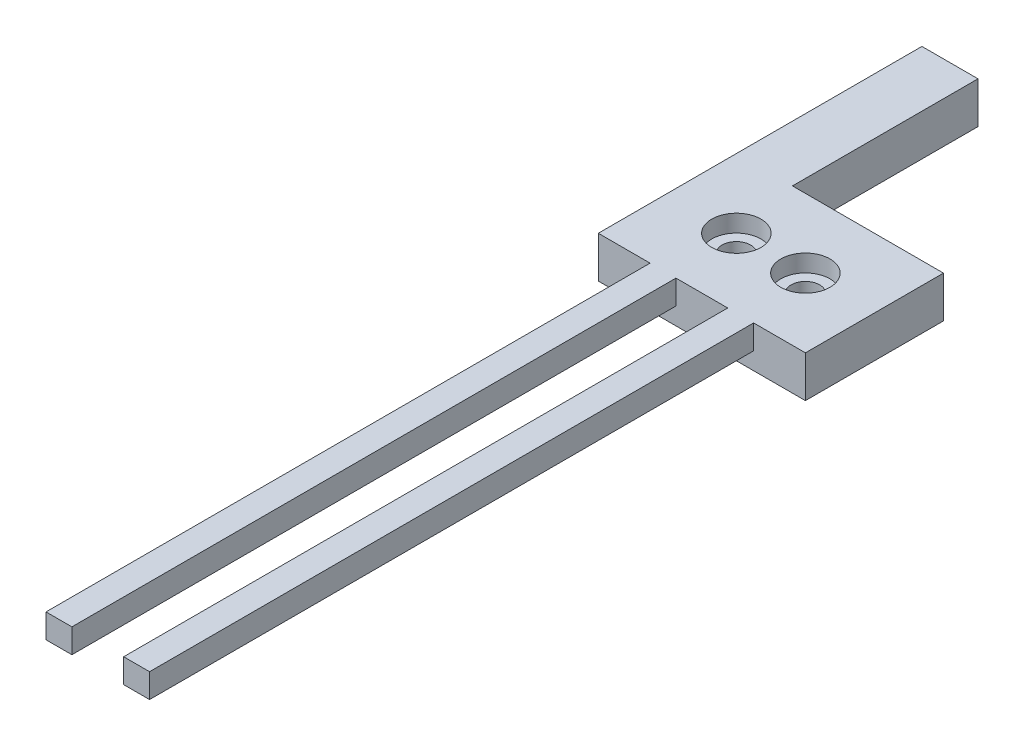
from build123d import *

# Parameters (mm, degrees)
SKETCH1_W           = 24
SKETCH1_H           = 16
SKETCH1_R           = 1.65
BOSS_EXTRUDE1_DEPTH = 4.8
SKETCH2_W           = 3
SKETCH2_H           = 2.8
BOSS_EXTRUDE2_DEPTH = 70
SKETCH3_R           = 2.85
CUT_EXTRUDE1_DEPTH  = 2
SKETCH4_W           = 6.5
SKETCH4_H           = 21.5
BOSS_EXTRUDE3_DEPTH = 4.8


with BuildPart() as part:
    # Sketch1 → Boss-Extrude1 (new body)
    with BuildSketch(Plane.XZ):
        with Locations((12, -8)):
            Rectangle(SKETCH1_W, SKETCH1_H)
        with Locations((8, -8)):
            Circle(SKETCH1_R, mode=Mode.SUBTRACT)
        with Locations((16, -8)):
            Circle(SKETCH1_R, mode=Mode.SUBTRACT)
    extrude(amount=BOSS_EXTRUDE1_DEPTH)

    # Sketch2 → Boss-Extrude2 (add)
    with BuildSketch(Plane.XY):
        with Locations((7.5, -1.4)):
            Rectangle(SKETCH2_W, SKETCH2_H)
        with Locations((16.5, -1.4)):
            Rectangle(SKETCH2_W, SKETCH2_H)
    extrude(amount=BOSS_EXTRUDE2_DEPTH)

    # Sketch3 → Cut-Extrude1 (cut)
    with BuildSketch(Plane(origin=(0, 0, 0), x_dir=(1, 0, 0), z_dir=(0, 1, 0))):
        with Locations((8, 8)):
            Circle(SKETCH3_R)
        with Locations((16, 8)):
            Circle(SKETCH3_R)
    extrude(amount=-CUT_EXTRUDE1_DEPTH, mode=Mode.SUBTRACT)

    # Sketch4 → Boss-Extrude3 (add)
    with BuildSketch(Plane(origin=(0, 0, 0), x_dir=(1, 0, 0), z_dir=(0, 1, 0))):
        with Locations((3.25, 26.75)):
            Rectangle(SKETCH4_W, SKETCH4_H)
    extrude(amount=-BOSS_EXTRUDE3_DEPTH)


solid = part.part
